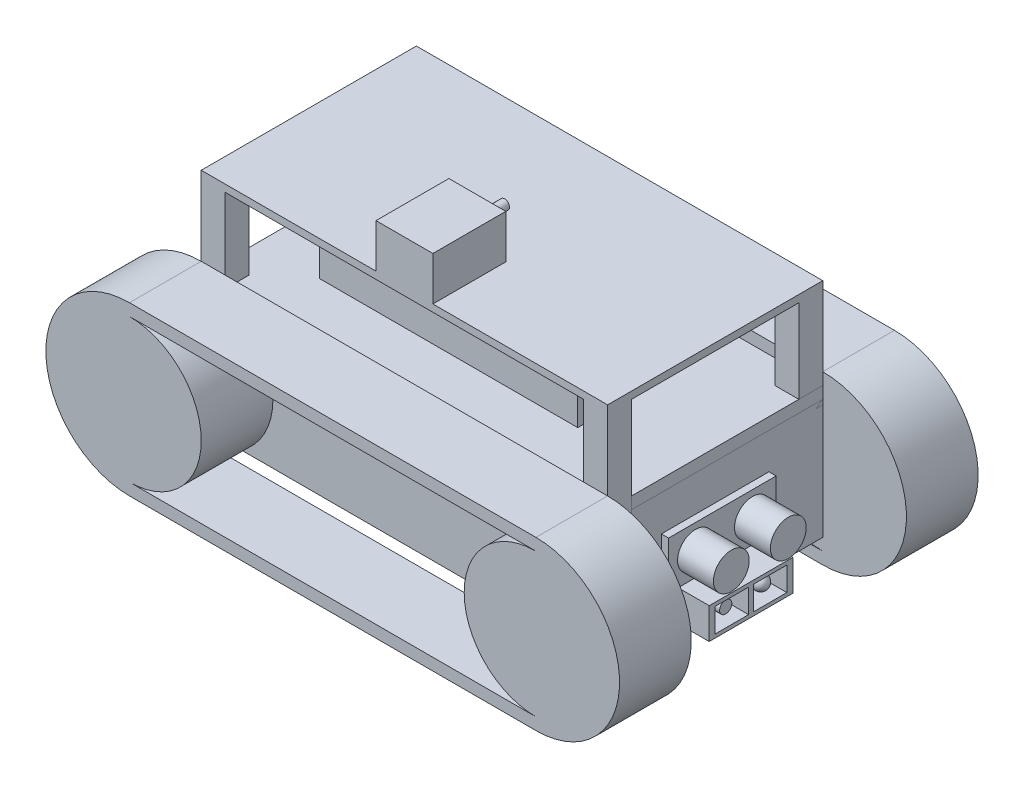
from build123d import *

# Parameters (mm, degrees)
SKETCH1_W            = 170
SKETCH1_H            = 90
BOSS_EXTRUDE1_DEPTH  = 50
SKETCH2_R            = 30
BOSS_EXTRUDE2_DEPTH  = 30
LPATTERN1_COUNT      = 2
LPATTERN1_PITCH      = 120
BOSS_EXTRUDE3_START  = -30
BOSS_EXTRUDE3_DEPTH  = 30
LPATTERN2_COUNT      = 2
LPATTERN2_PITCH      = 120
SKETCH4_W            = 170
SKETCH4_H            = 90
BOSS_EXTRUDE6_DEPTH  = 5
SKETCH6_W            = 108
SKETCH6_H            = 53
BOSS_EXTRUDE7_DEPTH  = 15
SKETCH7_W            = 170
SKETCH7_H            = 90
BOSS_EXTRUDE8_DEPTH  = 3
SKETCH8_W            = 23.8
SKETCH8_H            = 18.3
BOSS_EXTRUDE9_DEPTH  = 30.5
SKETCH9_R            = 2.00605959
BOSS_EXTRUDE10_DEPTH = 11.45
SKETCH10_W           = 45
SKETCH10_H           = 20
BOSS_EXTRUDE11_DEPTH = 3
SKETCH11_R           = 7.5
BOSS_EXTRUDE12_DEPTH = 15
SKETCH12_W           = 35
SKETCH12_H           = 13
SKETCH12_W_2         = 14
SKETCH12_H_2         = 10
BOSS_EXTRUDE13_DEPTH = 15
SKETCH13_R           = 2.55
BOSS_EXTRUDE14_DEPTH = 2.4
SKETCH14_R           = 3
BOSS_EXTRUDE15_DEPTH = 8.6
FILLET1_R            = 3
SKETCH15_W           = 35
SKETCH15_H           = 15
BOSS_EXTRUDE16_DEPTH = 13
SKETCH17_W           = 10
SKETCH17_H           = 30
CUT_EXTRUDE1_DEPTH   = 12
SKETCH18_W           = 10
SKETCH18_H           = 2
BOSS_EXTRUDE17_DEPTH = 12
SKETCH20_W           = 10
SKETCH20_H           = 10
BOSS_EXTRUDE20_DEPTH = 42


with BuildPart() as part:
    # Sketch1 → Boss-Extrude1 (new body)
    with BuildSketch(Plane(origin=(0, 0, 0), x_dir=(1, 0, 0), z_dir=(0, 1, 0))):
        with Locations((85, 45)):
            Rectangle(SKETCH1_W, SKETCH1_H)
    extrude(amount=BOSS_EXTRUDE1_DEPTH)

    # Sketch2 → Boss-Extrude2 (add)
    with BuildSketch(Plane.XY):
        with Locations((170, 25)):
            Circle(SKETCH2_R)
        with Locations((0, 25)):
            Circle(SKETCH2_R)
    boss_extrude2 = extrude(amount=BOSS_EXTRUDE2_DEPTH)

    # LPattern1: Boss-Extrude2 ×2
    with Locations(*[(0, 0, -i * LPATTERN1_PITCH) for i in range(1, LPATTERN1_COUNT)]):
        add(boss_extrude2)

    # Sketch3 → Boss-Extrude3 (add)
    with BuildSketch(Plane.XY.offset(30).offset(BOSS_EXTRUDE3_START)):
        with BuildLine():
            Line((0, 60), (170, 60))
            ThreePointArc((170, 60), (205, 25), (170, -10))
            Line((170, -10), (0, -10))
            ThreePointArc((0, -10), (-35, 25), (0, 60))
        make_face()
        with BuildLine():
            Line((170, 55), (0, 55))
            ThreePointArc((0, 55), (-30, 25), (0, -5))
            Line((0, -5), (170, -5))
            ThreePointArc((170, -5), (200, 25), (170, 55))
        make_face(mode=Mode.SUBTRACT)
    boss_extrude3 = extrude(amount=BOSS_EXTRUDE3_DEPTH)

    # LPattern2: Boss-Extrude3 ×2
    with Locations(*[(0, 0, -i * LPATTERN2_PITCH) for i in range(1, LPATTERN2_COUNT)]):
        add(boss_extrude3)

    # Sketch10 → Boss-Extrude11 (add)
    with BuildSketch(Plane(origin=(170, 0, 0), x_dir=(0, 0, -1), z_dir=(1, 0, 0))):
        with Locations((45, 25)):
            Rectangle(SKETCH10_W, SKETCH10_H)
    extrude(amount=BOSS_EXTRUDE11_DEPTH)

    # Sketch11 → Boss-Extrude12 (add)
    with BuildSketch(Plane(origin=(173, 0, 0), x_dir=(0, 0, -1), z_dir=(1, 0, 0))):
        with Locations((57.588236396, 25)):
            Circle(SKETCH11_R)
        with Locations((33.75, 25)):
            Circle(SKETCH11_R)
    extrude(amount=BOSS_EXTRUDE12_DEPTH)

    # Sketch12 → Boss-Extrude13 (add)
    with BuildSketch(Plane(origin=(170, 0, 0), x_dir=(0, 0, -1), z_dir=(1, 0, 0))):
        with Locations((45, 7.5)):
            Rectangle(SKETCH12_W, SKETCH12_H)
        with Locations((37, 7.5)):
            Rectangle(SKETCH12_W_2, SKETCH12_H_2, mode=Mode.SUBTRACT)
        with Locations((53, 7.5)):
            Rectangle(SKETCH12_W_2, SKETCH12_H_2, mode=Mode.SUBTRACT)
    extrude(amount=BOSS_EXTRUDE13_DEPTH)

    # Sketch15 → Boss-Extrude16 (add)
    with BuildSketch(Plane.ZY):
        with Locations((-45, 7.5)):
            Rectangle(SKETCH15_W, SKETCH15_H)
    extrude(amount=BOSS_EXTRUDE16_DEPTH)

    # Sketch17 → Cut-Extrude1 (cut)
    with BuildSketch(Plane.XZ):
        with Locations((-6.5, -45)):
            Rectangle(SKETCH17_W, SKETCH17_H)
    extrude(amount=-CUT_EXTRUDE1_DEPTH, mode=Mode.SUBTRACT)

    # Sketch18 → Boss-Extrude17 (add)
    with BuildSketch(Plane.XZ.offset(-12)):
        with Locations((-6.5, -44.41753742)):
            Rectangle(SKETCH18_W, SKETCH18_H)
    extrude(amount=BOSS_EXTRUDE17_DEPTH)


with BuildPart() as body_2:
    # Sketch4 → Boss-Extrude6 (new body)
    with BuildSketch(Plane(origin=(0, 50, 0), x_dir=(1, 0, 0), z_dir=(0, 1, 0))):
        with Locations((85, 45)):
            Rectangle(SKETCH4_W, SKETCH4_H)
    extrude(amount=BOSS_EXTRUDE6_DEPTH)


with BuildPart() as body_3:
    # Sketch6 → Boss-Extrude7 (new body)
    with BuildSketch(Plane(origin=(0, 60, 0), x_dir=(1, 0, 0), z_dir=(0, 1, 0))):
        with Locations((85, 45)):
            Rectangle(SKETCH6_W, SKETCH6_H)
    extrude(amount=BOSS_EXTRUDE7_DEPTH)


with BuildPart() as body_4:
    # Sketch7 → Boss-Extrude8 (new body)
    with BuildSketch(Plane(origin=(0, 90, 0), x_dir=(1, 0, 0), z_dir=(0, 1, 0))):
        with Locations((85, 45)):
            Rectangle(SKETCH7_W, SKETCH7_H)
    extrude(amount=BOSS_EXTRUDE8_DEPTH)

    # Sketch8 → Boss-Extrude9 (add)
    with BuildSketch(Plane.XY):
        with Locations((85, 102.15)):
            Rectangle(SKETCH8_W, SKETCH8_H)
    extrude(amount=-BOSS_EXTRUDE9_DEPTH)

    # Sketch9 → Boss-Extrude10 (add)
    with BuildSketch(Plane(origin=(0, 0, -30.5), x_dir=(-1, 0, 0), z_dir=(0, 0, -1))):
        with Locations((-85, 102.15)):
            Circle(SKETCH9_R)
    extrude(amount=BOSS_EXTRUDE10_DEPTH)

    # Sketch20 → Boss-Extrude20 (add)
    with BuildSketch(Plane.XZ.offset(-90)):
        with Locations((5, -5)):
            Rectangle(SKETCH20_W, SKETCH20_H)
        with Locations((165, -5)):
            Rectangle(SKETCH20_W, SKETCH20_H)
        with Locations((165, -85)):
            Rectangle(SKETCH20_W, SKETCH20_H)
        with Locations((5, -85)):
            Rectangle(SKETCH20_W, SKETCH20_H)
    extrude(amount=BOSS_EXTRUDE20_DEPTH)


with BuildPart() as body_5:
    # Sketch13 → Boss-Extrude14 (new body)
    with BuildSketch(Plane(origin=(180, 0, 0), x_dir=(0, 0, -1), z_dir=(1, 0, 0))):
        with Locations((37, 7.5)):
            Circle(SKETCH13_R)
    extrude(amount=BOSS_EXTRUDE14_DEPTH)


with BuildPart() as body_6:
    # Sketch14 → Boss-Extrude15 (new body)
    with BuildSketch(Plane(origin=(175.4, 0, 0), x_dir=(0, 0, -1), z_dir=(1, 0, 0))):
        with Locations((53, 7.864274774)):
            Circle(SKETCH14_R)
    extrude(amount=BOSS_EXTRUDE15_DEPTH)

    # Fillet1
    fillet1_edges = [body_6.edges().sort_by_distance(p)[0] for p in [
        (184, 7.864274774, -50),
    ]]
    fillet(fillet1_edges, radius=FILLET1_R)


solid = Compound([part.part, body_2.part, body_3.part, body_4.part, body_5.part, body_6.part])
